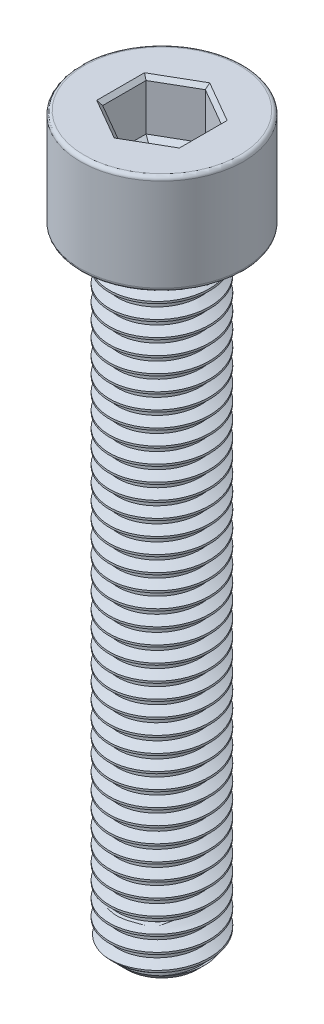
from build123d import *

# Parameters (mm, degrees)
SKETCH1_R           = 4
BOSS_EXTRUDE1_DEPTH = 50
THREAD1_PITCH       = 1.25
SKETCH2_R           = 6.5
BOSS_EXTRUDE2_DEPTH = 8
FILLET1_R           = 0.3
CUT_EXTRUDE1_DEPTH  = 4
CHAMFER1_SIZE       = 0.3
CUT_EXTRUDE2_DEPTH  = 0.4
CUT_EXTRUDE2_DRAFT  = -60


with BuildPart() as part:
    # Sketch1 → Boss-Extrude1 (new body)
    with BuildSketch(Plane(origin=(0, 0, 0), x_dir=(1, 0, 0), z_dir=(0, 1, 0))):
        with Locations(Location((0, 0, 0), (0, 0, 270))):
            Circle(SKETCH1_R)
    extrude(amount=BOSS_EXTRUDE1_DEPTH)

    # Thread1: arcs per turn and ends read off the stored shape
    # Thread1: the profile of Thread Profile1 profile screwed along a right-hand helix through 42.400003 turns, 8 arcs to a turn; built about Z, then put on its axis
    thread1_z = Axis((0, 0, 0), (0, 0, 1))
    thread1_corners = [(4.0003, 0, -0.000173205), (4.0003, 0, 1.093923202), (3.323417656, 0, 0.703124998), (3.323417656, 0, 0.390624998)]
    with BuildLine(mode=Mode.PRIVATE) as thread1_profile:
        Line(thread1_corners[0], thread1_corners[1])
        Line(thread1_corners[1], thread1_corners[2])
        Line(thread1_corners[2], thread1_corners[3])
        Line(thread1_corners[3], thread1_corners[0])
    thread1_cap = Face(thread1_profile.wire())
    thread1_turn_angles = [0, 22.5, 45, 67.5, 90, 112.5, 135, 157.5, 180, 202.5, 225, 247.5, 270, 292.5, 315, 337.5, 360]
    thread1_turn_weights = [1, 0.9238795325112867, 1, 0.9238795325112867, 1, 0.9238795325112867, 1, 0.9238795325112867, 1, 0.9238795325112867, 1, 0.9238795325112867, 1, 0.9238795325112867, 1, 0.9238795325112867, 1]
    thread1_turn_rails = [Edge.make_bspline([Vector(p[0], p[1], 0).rotate(thread1_z, thread1_turn_angles[k]) / thread1_turn_weights[k] + Vector(0, 0, p[2] + THREAD1_PITCH * thread1_turn_angles[k] / 360) for k in range(17)], [0, 0, 0, 1, 1, 2, 2, 3, 3, 4, 4, 5, 5, 6, 6, 7, 7, 8, 8, 8], 2, thread1_turn_weights) for p in thread1_corners]
    thread1_turn_sides = [Face.make_surface_from_curves(thread1_turn_rails[p[0]], thread1_turn_rails[p[1]]) for p in [(0, 1), (1, 2), (2, 3), (3, 0)]]
    thread1_last_angles = [15120, 15142.5, 15165, 15187.5, 15210, 15232.5, 15255, 15259.5005, 15264.001]
    thread1_last_weights = [1, 0.9238795325112867, 1, 0.9238795325112867, 1, 0.9238795325112867, 1, 0.9969166490103938, 1]
    thread1_last_rails = [Edge.make_bspline([Vector(p[0], p[1], 0).rotate(thread1_z, thread1_last_angles[k]) / thread1_last_weights[k] + Vector(0, 0, p[2] + THREAD1_PITCH * thread1_last_angles[k] / 360) for k in range(9)], [0, 0, 0, 1, 1, 2, 2, 3, 3, 4, 4, 4], 2, thread1_last_weights) for p in thread1_corners]
    thread1_last_sides = [Face.make_surface_from_curves(thread1_last_rails[p[0]], thread1_last_rails[p[1]]) for p in [(0, 1), (1, 2), (2, 3), (3, 0)]]
    thread1 = Plane(origin=(0, 52, 0), x_dir=(-1, 0, 0), z_dir=(0, -1, 0)) * Solid(Shell([*[p.moved(Location((0, 0, THREAD1_PITCH * i))) for i in range(42) for p in thread1_turn_sides], *thread1_last_sides, thread1_cap, thread1_cap.rotate(thread1_z, 15264.001).moved(Location((0, 0, THREAD1_PITCH * 15264.001 / 360)))]))
    add(thread1, mode=Mode.SUBTRACT)

    # Sketch2 → Boss-Extrude2 (add)
    with BuildSketch(Plane(origin=(0, 50, 0), x_dir=(1, 0, 0), z_dir=(0, 1, 0))):
        with Locations(Location((0, 0, 0), (0, 0, 270))):
            Circle(SKETCH2_R)
    extrude(amount=BOSS_EXTRUDE2_DEPTH)

    # Sketch5 → Cut-Revolve1 (revolve, cut)
    with BuildSketch(Plane.XY, mode=Mode.PRIVATE) as cut_revolve1_sk:
        Polygon((4.01, 0), (4.01, 1.2), (2.81, 0), align=None)
    revolve(cut_revolve1_sk.sketch.rotate(Axis((0, 0, 0), (0, 1, 0)), 261.497055382), axis=Axis((0, 0, 0), (0, 1, 0)), mode=Mode.SUBTRACT)

    # Fillet1
    fillet1_edges = [part.edges().sort_by_distance(p)[0] for p in [
        (0, 50, -6.5),
        (0, 58, -6.5),
    ]]
    fillet(fillet1_edges, radius=FILLET1_R)

    # Sketch6 → Cut-Extrude1 (cut)
    with BuildSketch(Plane(origin=(0, 58, 0), x_dir=(1, 0, 0), z_dir=(0, 1, 0))):
        Polygon((0, 3.464101615), (-3, 1.732050808), (-3, -1.732050808), (0, -3.464101615), (3, -1.732050808), (3, 1.732050808), align=None)
    extrude(amount=-CUT_EXTRUDE1_DEPTH, mode=Mode.SUBTRACT)

    # Chamfer1
    chamfer1_edges = [part.edges().sort_by_distance(p)[0] for p in [
        (1.5, 58, -2.598076211),
        (-1.5, 58, -2.598076211),
        (-3, 58, 0),
        (-1.5, 58, 2.598076211),
        (1.5, 58, 2.598076211),
        (3, 58, 0),
    ]]
    chamfer(chamfer1_edges, length=CHAMFER1_SIZE)


with BuildPart() as cut_extrude2_tool:
    # Sketch7 → Cut-Extrude2 (with draft: the straight prism first)
    with BuildSketch(Plane(origin=(0, 54, 0), x_dir=(1, 0, 0), z_dir=(0, 1, 0))):
        Polygon((0, 3.464101615), (-3, 1.732050808), (-3, -1.732050808), (0, -3.464101615), (3, -1.732050808), (3, 1.732050808), align=None)
    extrude(amount=-CUT_EXTRUDE2_DEPTH)
    # Cut-Extrude2: the draft: its side faces are tilted about the plane it starts from
    cut_extrude2_sides = [cut_extrude2_tool.faces().sort_by_distance(p)[0] for p in [
        (-1.5, 53.8, -2.598076211),
        (-3, 53.8, 0),
        (-1.5, 53.8, 2.598076211),
        (1.5, 53.8, 2.598076211),
        (3, 53.8, 0),
        (1.5, 53.8, -2.598076211),
    ]]
    draft(cut_extrude2_sides, Plane(origin=(0, 54, 0), x_dir=(1, 0, 0), z_dir=(0, 1, 0)), CUT_EXTRUDE2_DRAFT)


with BuildPart() as part_1:
    add(part.part)

    # Cut-Extrude2: cut by cut_extrude2_tool
    add(cut_extrude2_tool.part, mode=Mode.SUBTRACT)


solid = part_1.part
